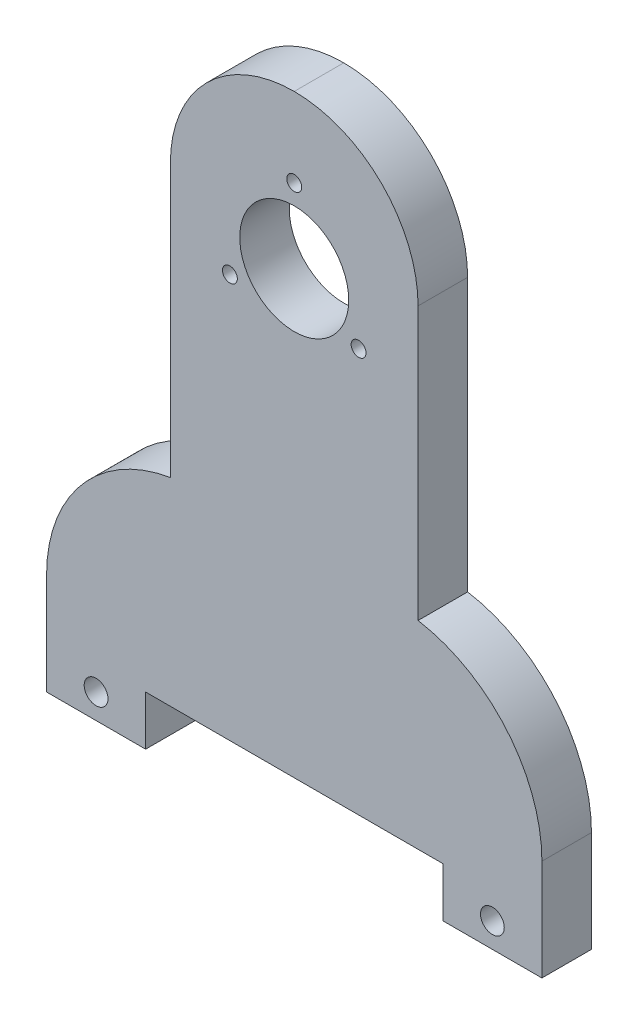
from build123d import *

# Parameters (mm, degrees)
SKETCH2_W           = 100
SKETCH2_H           = 130
BOSS_EXTRUDE1_DEPTH = 10
SKETCH4_W           = 60
SKETCH4_H           = 10
SKETCH4_W_2         = 25
SKETCH4_H_2         = 80
CUT_EXTRUDE1_DEPTH  = 55
SKETCH6_W           = 60
SKETCH6_H           = 6
BOSS_EXTRUDE2_DEPTH = 15
SKETCH10_R          = 2.4
CUT_EXTRUDE3_DEPTH  = 15
FILLET6_R           = 30
FILLET7_R           = 30
RIB9_REACH          = 85.367
SKETCH12_WALL_W     = 219.977831906
SKETCH12_WALL_H     = 6
RIB10_START         = -6
RIB10_DEPTH         = 6
SKETCH14_R          = 2
CUT_EXTRUDE4_DEPTH  = 15
FILLET8_R           = 25
SKETCH15_R          = 11
CUT_EXTRUDE5_DEPTH  = 15
SKETCH17_R          = 1.5
CUT_EXTRUDE6_DEPTH  = 15


# Read off the part's stored shape, not the designer's step: Rib10
# Some blends are built 0.0001 mm under size
with BuildPart() as part:
    # Sketch2 → Boss-Extrude1 (new body)
    with BuildSketch(Plane.XY):
        Rectangle(SKETCH2_W, SKETCH2_H)
    extrude(amount=BOSS_EXTRUDE1_DEPTH)

    # Sketch4 → Cut-Extrude1 (cut)
    with BuildSketch(Plane.XY.offset(10)):
        with Locations((0, -60)):
            Rectangle(SKETCH4_W, SKETCH4_H)
        with Locations((-37.5, 25)):
            Rectangle(SKETCH4_W_2, SKETCH4_H_2)
        with Locations((37.5, 25)):
            Rectangle(SKETCH4_W_2, SKETCH4_H_2)
    extrude(amount=-CUT_EXTRUDE1_DEPTH, mode=Mode.SUBTRACT)

    # Sketch6 → Boss-Extrude2 (add)
    with BuildSketch(Plane(origin=(0, 0, 0), x_dir=(-1, 0, 0), z_dir=(0, 0, -1))):
        with Locations((0, -52)):
            Rectangle(SKETCH6_W, SKETCH6_H)
    extrude(amount=BOSS_EXTRUDE2_DEPTH)

    # Sketch10 → Cut-Extrude3 (cut)
    with BuildSketch(Plane.XY.offset(10)):
        with Locations((-40, -60)):
            Circle(SKETCH10_R)
        with Locations((40, -60)):
            Circle(SKETCH10_R)
    extrude(amount=-CUT_EXTRUDE3_DEPTH, mode=Mode.SUBTRACT)

    # Fillet6
    # the kernel refuses this fillet: 30 mm, written as the material it takes off along each edge
    with BuildSketch(Plane(origin=(50, -15, 83.950997289), x_dir=(-1, 0, 0), z_dir=(0, 0, -1))) as fillet6_piece_1:
        with BuildLine():
            CenterArc((30, -29.580398915), FILLET6_R, 99.594068227, 80.405931773)
            Line((0, -29.580398916), (-0.6, -29.580398916))
            Line((-0.6, -29.580398916), (-0.6, 0))
            Line((-0.6, 0), (0, 0.6))
            ThreePointArc((0, 0.6), (12.5, 0.6), (24.9, 0.591607978))
            Line((24.9, 0.591607978), (25, 0))
        make_face()
    extrude(amount=157.901994578, mode=Mode.SUBTRACT)

    # Fillet7
    # the kernel refuses this fillet: 30 mm, written as the material it takes off along each edge
    with BuildSketch(Plane(origin=(-50, -15, 83.950997289), x_dir=(0, -1, 0), z_dir=(0, 0, -1))) as fillet7_piece_1:
        with BuildLine():
            CenterArc((29.580398916, -30), FILLET7_R, 90, 80.405931773)
            Line((0, -25), (-0.591607978, -24.9))
            ThreePointArc((-0.591607978, -24.9), (-0.6, -12.5), (-0.6, 0))
            Line((-0.6, 0), (0, 0.6))
            Line((0, 0.6), (29.580398916, 0.6))
            Line((29.580398916, 0.6), (29.580398916, 0))
        make_face()
    extrude(amount=157.901994578, mode=Mode.SUBTRACT)

    # Sketch12 wall → Rib9 (add, up to next)
    with BuildSketch(Plane(origin=(0, -24.5, -7.5), x_dir=(0, 0.956199955507, 0.292714272094), z_dir=(0, -0.292714272094, 0.956199955507)), mode=Mode.PRIVATE) as rib9_sk1:
        Rectangle(SKETCH12_WALL_W, SKETCH12_WALL_H)
    rib9_tool1 = extrude(rib9_sk1.sketch, amount=RIB9_REACH, mode=Mode.PRIVATE) - part.part
    add(rib9_tool1.solids().sort_by_distance((0, -24.5, -7.5))[0])

    # Rib10 outline → Rib10 (add)
    with BuildSketch(Plane.ZY.offset(30).offset(RIB10_START)):
        Polygon((0, -25.879609738), (-15, -49), (0, -49), align=None)
    rib10 = extrude(amount=RIB10_DEPTH)

    # Mirror4: Rib10 across plane
    add(rib10.mirror(Plane(origin=(0, 0, 0), x_dir=(0, 0, 1), z_dir=(1, 0, 0))))

    # Sketch14 → Cut-Extrude4 (cut)
    with BuildSketch(Plane(origin=(0, -49, 0), x_dir=(1, 0, 0), z_dir=(0, 1, 0))):
        with Locations(Location((-13.5, 7.5, 0), (0, 0, 270))):
            Circle(SKETCH14_R)
        with Locations(Location((13.5, 7.5, 0), (0, 0, 270))):
            Circle(SKETCH14_R)
    extrude(amount=-CUT_EXTRUDE4_DEPTH, mode=Mode.SUBTRACT)

    # Fillet8
    fillet8_edges = [part.edges().sort_by_distance(p)[0] for p in [
        (25, 65, 5),
        (-25, 65, 5),
    ]]
    fillet(fillet8_edges, radius=FILLET8_R - 0.0001)  # a hair under: the kernel refuses the full size

    # Sketch15 → Cut-Extrude5 (cut)
    with BuildSketch(Plane.XY.offset(10)):
        with Locations((0, 34)):
            Circle(SKETCH15_R)
    extrude(amount=-CUT_EXTRUDE5_DEPTH, mode=Mode.SUBTRACT)

    # Sketch17 → Cut-Extrude6 (cut)
    with BuildSketch(Plane.XY.offset(10)):
        with Locations((0, 49)):
            Circle(SKETCH17_R)
        with Locations((12.990381057, 26.5)):
            Circle(SKETCH17_R)
        with Locations((-12.990381057, 26.5)):
            Circle(SKETCH17_R)
    extrude(amount=-CUT_EXTRUDE6_DEPTH, mode=Mode.SUBTRACT)


solid = part.part
